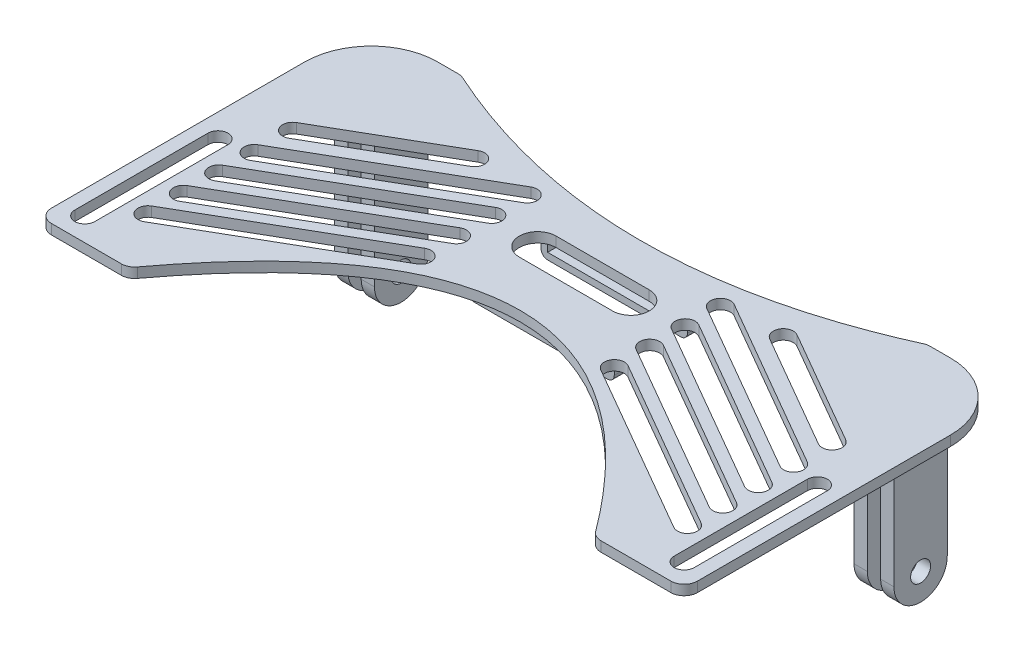
from build123d import *

# Parameters (mm, degrees)
SKETCH_2_W          = 8
SKETCH_2_H          = 12
EXTRUDE_1_DEPTH     = 1.5
EXTRUDE_1_2_DEPTH   = 1.5
SKETCH_3_W          = 2
SKETCH_3_H          = 8
EXTRUDE_2_DEPTH     = 24.5
FILLET_1_R          = 4
FILLET_2_R          = 4
SKETCH_4_R          = 1.5
CUT_EXTRUDE_1_DEPTH = 90.622820755
EXTRUDE_3_DEPTH     = 1.5
SKETCH_8_W          = 22
SKETCH_8_H          = 2
EXTRUDE_4_DEPTH     = 4
SKETCH_9_W          = 20
SKETCH_9_H          = 3
CUT_EXTRUDE_2_DEPTH = 61.675365801
FILLET_4_R          = 2
CUT_EXTRUDE_4_DEPTH = 4
FILLET_5_R          = 1
FILLET_6_R          = 1


with BuildPart() as part:
    # 草图2 → 凸台-拉伸1 (new body)
    with BuildSketch(Plane(origin=(0, 0, 0), x_dir=(1, 0, 0), z_dir=(0, 1, 0))):
        with Locations((-39, 0)):
            Rectangle(SKETCH_2_W, SKETCH_2_H)
    extrude(amount=EXTRUDE_1_DEPTH)



with BuildPart() as body_2:
    # 草图2 → Extrude 1 2 (new body)
    with BuildSketch(Plane(origin=(0, 0, 0), x_dir=(1, 0, 0), z_dir=(0, 1, 0))):
        with Locations((39, 0)):
            Rectangle(SKETCH_2_W, SKETCH_2_H)
    extrude(amount=EXTRUDE_1_2_DEPTH)


with BuildPart() as part_1:
    add(part.part)

    add(body_2.part)  # 凸台-拉伸2 merges body 2
    # 草图3 → 凸台-拉伸2 (add)
    with BuildSketch(Plane(origin=(0, 0, 0), x_dir=(1, 0, 0), z_dir=(0, 1, 0))):
        with Locations((-37, 0)):
            Rectangle(SKETCH_3_W, SKETCH_3_H)
        with Locations((-41, 0)):
            Rectangle(SKETCH_3_W, SKETCH_3_H)
        with Locations((41, 0)):
            Rectangle(SKETCH_3_W, SKETCH_3_H)
        with Locations((37, 0)):
            Rectangle(SKETCH_3_W, SKETCH_3_H)
    extrude(amount=-EXTRUDE_2_DEPTH)

    # 圆角1
    fillet_1_edges = [part_1.edges().sort_by_distance(p)[0] for p in [
        (-41, -24.5, -4),
        (-37, -24.5, -4),
        (-37, -24.5, 4),
        (-41, -24.5, 4),
    ]]
    fillet(fillet_1_edges, radius=FILLET_1_R - 0.0001)  # a hair under: the kernel refuses the full size

    # 圆角2
    fillet_2_edges = [part_1.edges().sort_by_distance(p)[0] for p in [
        (37, -24.5, 4),
        (41, -24.5, 4),
        (41, -24.5, -4),
        (37, -24.5, -4),
    ]]
    fillet(fillet_2_edges, radius=FILLET_2_R - 0.0001)  # a hair under: the kernel refuses the full size

    # 草图4 → 切除-拉伸1 (cut, through all)
    with BuildSketch(Plane(origin=(43, 0, 0), x_dir=(0, 0, -1), z_dir=(1, 0, 0))):
        with Locations((0, -20.5)):
            Circle(SKETCH_4_R)
    extrude(amount=-CUT_EXTRUDE_1_DEPTH, mode=Mode.SUBTRACT)

    # 草图6 → 凸台-拉伸3 (add)
    with BuildSketch(Plane(origin=(0, 0, 0), x_dir=(1, 0, 0), z_dir=(0, 1, 0))):
        with BuildLine():
            Line((48.5, -2), (48.5, -40))
            ThreePointArc((48.5, -40), (47.914213562, -41.414213562), (46.5, -42))
            Line((46.5, -42), (35, -42))
            add(Edge.make_bspline(
                [(-35, -42), (0, 5.776780805), (35, -42)],
                knots=[0, 0, 0, 1, 1, 1], degree=2))
            Line((-35, -42), (-46.5, -42))
            ThreePointArc((-46.5, -42), (-47.914213562, -41.414213562), (-48.5, -40))
            Line((-48.5, -40), (-48.5, -2))
            ThreePointArc((-48.5, -2), (-45.571067812, 5.071067812), (-38.5, 8))
            Line((-38.5, 8), (-35, 8))
            add(Edge.make_bspline(
                [(-35, 8), (0, -8), (35, 8)],
                knots=[0, 0, 0, 1, 1, 1], degree=2))
            Line((35, 8), (38.5, 8))
            ThreePointArc((38.5, 8), (45.571067812, 5.071067812), (48.5, -2))
        make_face()
        with BuildLine():
            Line((-43.5, -18.5), (-43.5, -38.5))
            ThreePointArc((-43.5, -38.5), (-45, -40), (-46.5, -38.5))
            Line((-46.5, -38.5), (-46.5, -18.5))
            ThreePointArc((-46.5, -18.5), (-45, -17), (-43.5, -18.5))
        make_face(mode=Mode.SUBTRACT)
        with BuildLine():
            Line((46.5, -18.5), (46.5, -38.5))
            ThreePointArc((46.5, -38.5), (45, -40), (43.5, -38.5))
            Line((43.5, -38.5), (43.5, -18.5))
            ThreePointArc((43.5, -18.5), (45, -17), (46.5, -18.5))
        make_face(mode=Mode.SUBTRACT)
    extrude(amount=EXTRUDE_3_DEPTH)

    # 草图8 → 凸台-拉伸4 (add)
    with BuildSketch(Plane(origin=(0, 0, 0), x_dir=(-1, 0, 0), z_dir=(0, -1, 0))):
        with Locations((0, -3)):
            Rectangle(SKETCH_8_W, SKETCH_8_H)
        with Locations((0, -14)):
            Rectangle(SKETCH_8_W, SKETCH_8_H)
    extrude(amount=EXTRUDE_4_DEPTH)

    # 草图9 → 切除-拉伸2 (cut, through all)
    with BuildSketch(Plane.XY.offset(15)):
        with Locations((0, -1.5)):
            Rectangle(SKETCH_9_W, SKETCH_9_H)
    extrude(amount=-CUT_EXTRUDE_2_DEPTH, mode=Mode.SUBTRACT)

    # 圆角4
    fillet_4_edges = [part_1.edges().sort_by_distance(p)[0] for p in [
        (-35, 0.75, -8),
        (35, 0.75, -8),
        (35, 0.75, 42),
        (-35, 0.75, 42),
    ]]
    fillet(fillet_4_edges, radius=FILLET_4_R)

    # 草图13 → 切除-拉伸4 (cut)
    with BuildSketch(Plane(origin=(0, 1.5, 0), x_dir=(1, 0, 0), z_dir=(0, 1, 0))):
        with BuildLine():
            Line((-41.25, -32.200961894), (-15.269237886, -17.200961894))
            ThreePointArc((-15.269237886, -17.200961894), (-13.220199781, -17.75), (-13.769237886, -19.799038106))
            Line((-13.769237886, -19.799038106), (-39.75, -34.799038106))
            ThreePointArc((-39.75, -34.799038106), (-41.799038106, -34.25), (-41.25, -32.200961894))
        make_face()
        with BuildLine():
            Line((-41.25, -26.889339418), (-15.269237886, -11.889339418))
            ThreePointArc((-15.269237886, -11.889339418), (-13.220199781, -12.438377523), (-13.769237886, -14.487415629))
            Line((-13.769237886, -14.487415629), (-39.75, -29.487415629))
            ThreePointArc((-39.75, -29.487415629), (-41.799038106, -28.938377523), (-41.25, -26.889339418))
        make_face()
        with BuildLine():
            Line((-41.25, -21.577716941), (-15.269237886, -6.577716941))
            ThreePointArc((-15.269237886, -6.577716941), (-13.220199781, -7.126755047), (-13.769237886, -9.175793153))
            Line((-13.769237886, -9.175793153), (-39.75, -24.175793153))
            ThreePointArc((-39.75, -24.175793153), (-41.799038106, -23.626755047), (-41.25, -21.577716941))
        make_face()
        with BuildLine():
            Line((-41.25, -16.266094465), (-15.269237886, -1.266094465))
            ThreePointArc((-15.269237886, -1.266094465), (-13.220199781, -1.81513257), (-13.769237886, -3.864170676))
            Line((-13.769237886, -3.864170676), (-39.75, -18.864170676))
            ThreePointArc((-39.75, -18.864170676), (-41.799038106, -18.31513257), (-41.25, -16.266094465))
        make_face()
        with BuildLine():
            Line((-41.25, -10.492591773), (-23.929491924, -0.492591773))
            ThreePointArc((-23.929491924, -0.492591773), (-21.880453819, -1.041629878), (-22.429491924, -3.090667984))
            Line((-22.429491924, -3.090667984), (-39.75, -13.090667984))
            ThreePointArc((-39.75, -13.090667984), (-41.799038106, -12.541629878), (-41.25, -10.492591773))
        make_face()
        with BuildLine():
            Line((-7, -5.75), (7, -5.75))
            ThreePointArc((7, -5.75), (9.75, -8.5), (7, -11.25))
            Line((7, -11.25), (-7, -11.25))
            ThreePointArc((-7, -11.25), (-9.75, -8.5), (-7, -5.75))
        make_face()
        with BuildLine():
            Line((41.25, -32.200961894), (15.269237886, -17.200961894))
            ThreePointArc((15.269237886, -17.200961894), (13.220199781, -17.75), (13.769237886, -19.799038106))
            Line((13.769237886, -19.799038106), (39.75, -34.799038106))
            ThreePointArc((39.75, -34.799038106), (41.799038106, -34.25), (41.25, -32.200961894))
        make_face()
        with BuildLine():
            Line((41.25, -26.889339418), (15.269237886, -11.889339418))
            ThreePointArc((15.269237886, -11.889339418), (13.220199781, -12.438377523), (13.769237886, -14.487415629))
            Line((13.769237886, -14.487415629), (39.75, -29.487415629))
            ThreePointArc((39.75, -29.487415629), (41.799038106, -28.938377523), (41.25, -26.889339418))
        make_face()
        with BuildLine():
            Line((41.25, -21.577716941), (15.269237886, -6.577716941))
            ThreePointArc((15.269237886, -6.577716941), (13.220199781, -7.126755047), (13.769237886, -9.175793153))
            Line((13.769237886, -9.175793153), (39.75, -24.175793153))
            ThreePointArc((39.75, -24.175793153), (41.799038106, -23.626755047), (41.25, -21.577716941))
        make_face()
        with BuildLine():
            Line((41.25, -16.266094465), (15.269237886, -1.266094465))
            ThreePointArc((15.269237886, -1.266094465), (13.220199781, -1.81513257), (13.769237886, -3.864170676))
            Line((13.769237886, -3.864170676), (39.75, -18.864170676))
            ThreePointArc((39.75, -18.864170676), (41.799038106, -18.31513257), (41.25, -16.266094465))
        make_face()
        with BuildLine():
            Line((41.25, -10.492591773), (23.929491924, -0.492591773))
            ThreePointArc((23.929491924, -0.492591773), (21.880453819, -1.041629878), (22.429491924, -3.090667984))
            Line((22.429491924, -3.090667984), (39.75, -13.090667984))
            ThreePointArc((39.75, -13.090667984), (41.799038106, -12.541629878), (41.25, -10.492591773))
        make_face()
    extrude(amount=-CUT_EXTRUDE_4_DEPTH, mode=Mode.SUBTRACT)

    # 圆角5
    fillet_5_edges = [part_1.edges().sort_by_distance(p)[0] for p in [
        (36, 0, 0),
        (42, 0, 0),
        (-36, 0, 0),
        (-42, 0, 0),
    ]]
    fillet(fillet_5_edges, radius=FILLET_5_R)

    # 圆角6
    fillet_6_edges = [part_1.edges().sort_by_distance(p)[0] for p in [
        (11, -4, 3),
        (-11, -4, 3),
        (11, -4, 14),
        (-11, -4, 14),
    ]]
    fillet(fillet_6_edges, radius=FILLET_6_R)


solid = part_1.part
